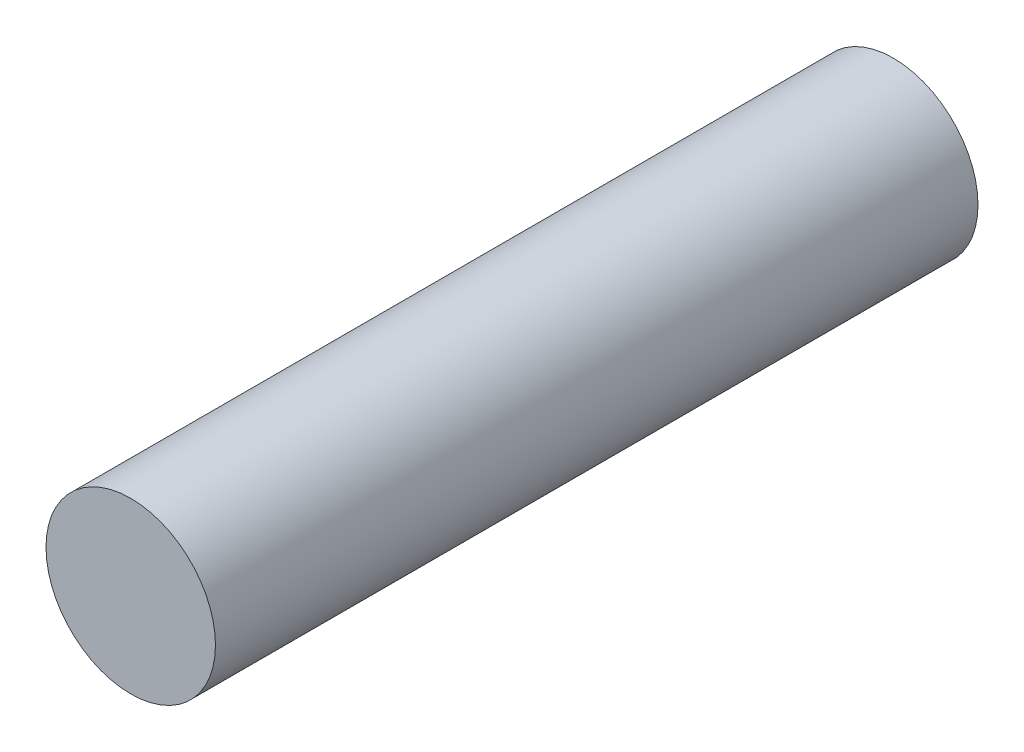
from build123d import *

# Parameters (mm, degrees)
SKETCH1_R           = 1
BOSS_EXTRUDE1_DEPTH = 9


with BuildPart() as part:
    # Sketch1 → Boss-Extrude1 (new body)
    with BuildSketch(Plane.XY):
        Circle(SKETCH1_R)
    extrude(amount=BOSS_EXTRUDE1_DEPTH)


solid = part.part
